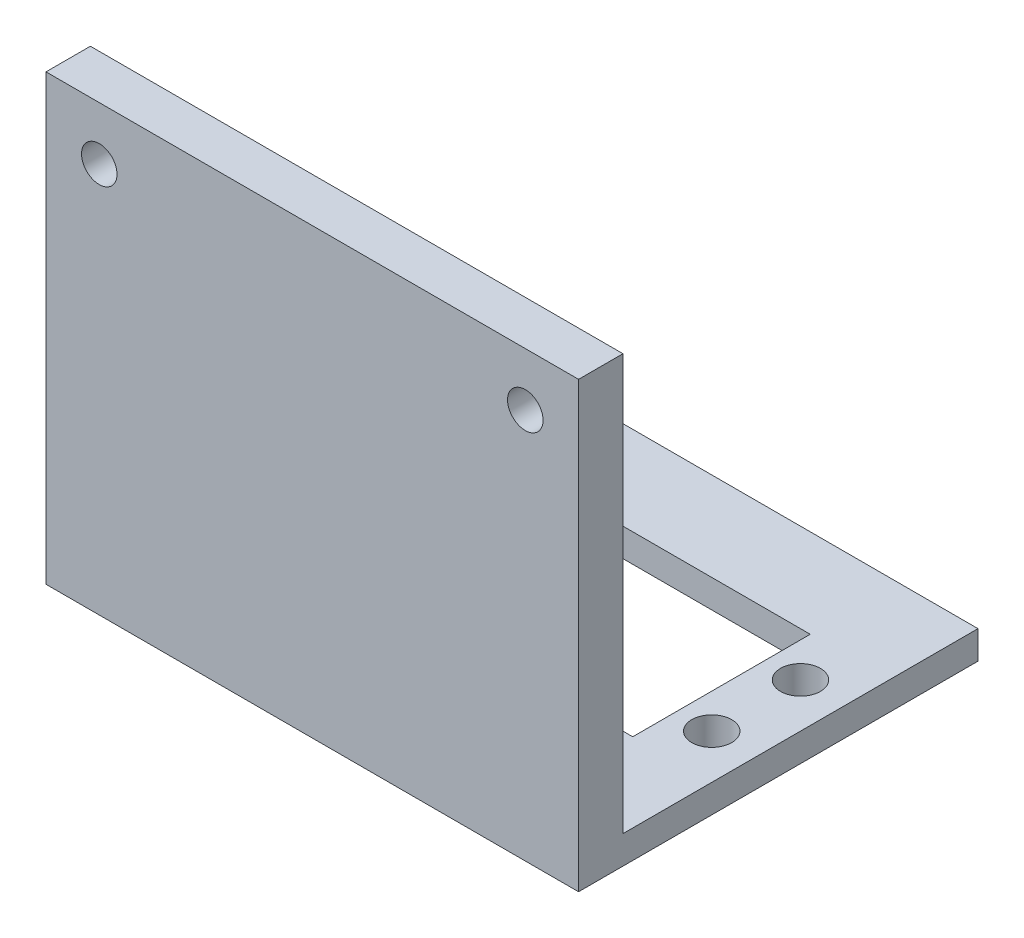
from build123d import *

# Parameters (mm, degrees)
SKETCH1_W             = 60
SKETCH1_H             = 40
SKETCH1_R             = 2.25
SKETCH1_W_2           = 41
SKETCH1_H_2           = 20
BOSS_EXTRUDE1_DEPTH   = 3.175
SKETCH2_W             = 60
SKETCH2_H             = 50
BOSS_EXTRUDE2_DEPTH   = 5
F_4_0MM_DOWEL_HOLE1_D = 4


with BuildPart() as part:
    # Sketch1 → Boss-Extrude1 (new body)
    with BuildSketch(Plane(origin=(0, 0, 0), x_dir=(1, 0, 0), z_dir=(0, 1, 0))):
        Rectangle(SKETCH1_W, SKETCH1_H)
        with Locations((25, 5)):
            Circle(SKETCH1_R, mode=Mode.SUBTRACT)
        with Locations((-23.8, 5)):
            Circle(SKETCH1_R, mode=Mode.SUBTRACT)
        with Locations((-23.8, -5)):
            Circle(SKETCH1_R, mode=Mode.SUBTRACT)
        with Locations((25, -5)):
            Circle(SKETCH1_R, mode=Mode.SUBTRACT)
        with Locations((0.6, 0)):
            Rectangle(SKETCH1_W_2, SKETCH1_H_2, mode=Mode.SUBTRACT)
    extrude(amount=BOSS_EXTRUDE1_DEPTH)

    # Sketch2 → Boss-Extrude2 (add)
    with BuildSketch(Plane.XY.offset(20)):
        with Locations((0, 25)):
            Rectangle(SKETCH2_W, SKETCH2_H)
    extrude(amount=BOSS_EXTRUDE2_DEPTH)

    # Ø4.0mm Dowel Hole1 (through all)
    with Locations(Plane(origin=(0, 0, 20), x_dir=(-1, 0, 0), z_dir=(0, 0, -1))):
        with Locations((-24, 44), (24, 44)):
            Hole(F_4_0MM_DOWEL_HOLE1_D / 2)


solid = part.part
